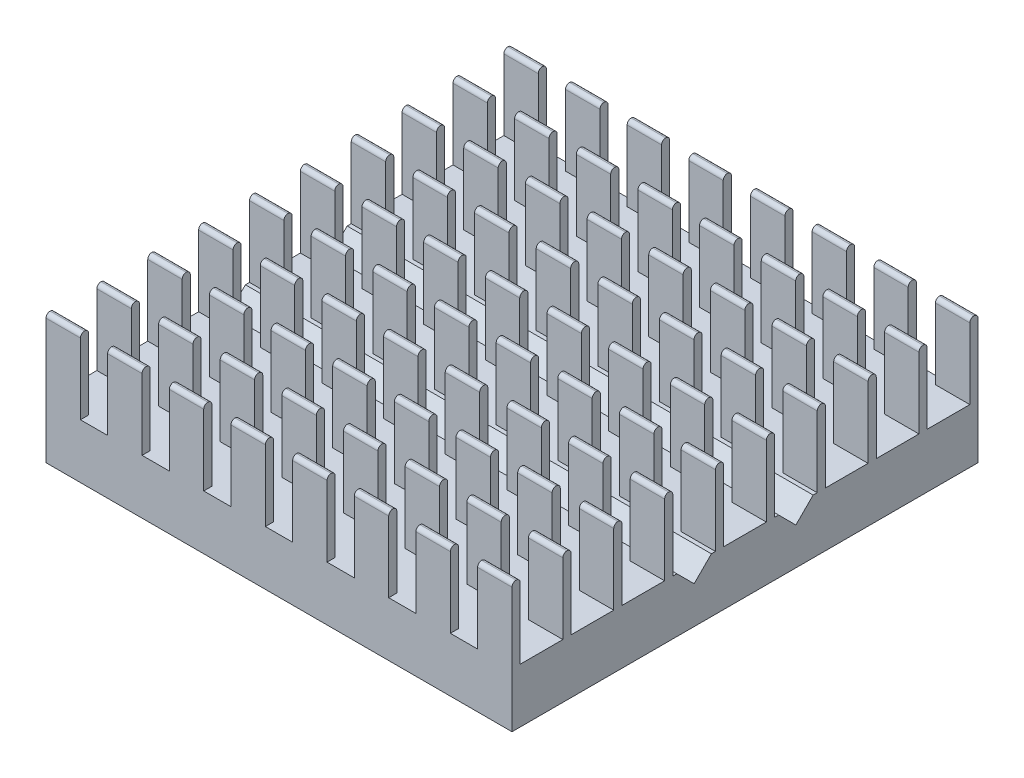
from build123d import *

# Parameters (mm, degrees)
BOSS_EXTRUDE1_START     = -4.75
SKETCH3_W               = 34.25
SKETCH3_H               = 34.25
BOSS_EXTRUDE1_DEPTH     = 4
BOSS_EXTRUDE2_START     = -0.75
SKETCH4_W               = 2.53
SKETCH4_H               = 0.6
BOSS_EXTRUDE2_DEPTH     = 5.5
FILLET1_R               = 0.3
LPATTERN1_COUNT         = 8
LPATTERN1_PITCH         = 4.531428571
LPATTERN1_COUNT_DIR2    = 10
LPATTERN1_PITCH_DIR2    = 3.738888889
FILLET1_OF_LPATTERN1_R  = 0.3
CUT_EXTRUDE1_DEPTH      = 25.679824756
CUT_EXTRUDE1_DEPTH_BACK = 25.679824756


with BuildPart() as part:
    # Sketch3 → Boss-Extrude1 (new body)
    with BuildSketch(Plane(origin=(0, 0, 0), x_dir=(1, 0, 0), z_dir=(0, 1, 0)).offset(BOSS_EXTRUDE1_START)):
        Rectangle(SKETCH3_W, SKETCH3_H)
    extrude(amount=BOSS_EXTRUDE1_DEPTH)

    # Sketch4 → Boss-Extrude2 (add)
    with BuildSketch(Plane(origin=(0, 0, 0), x_dir=(1, 0, 0), z_dir=(0, 1, 0)).offset(BOSS_EXTRUDE2_START)):
        with Locations((-15.86, -16.825)):
            Rectangle(SKETCH4_W, SKETCH4_H)
    boss_extrude2 = extrude(amount=BOSS_EXTRUDE2_DEPTH)

    # Fillet1
    fillet1_edges = [part.edges().sort_by_distance(p)[0] for p in [
        (-15.86, 4.75, 16.525),
        (-15.86, 4.75, 17.125),
    ]]
    fillet(fillet1_edges, radius=FILLET1_R - 0.0001)  # a hair under: the kernel refuses the full size

    # LPattern1: Boss-Extrude2 8 × 10
    with Locations(*[(i * LPATTERN1_PITCH, 0, -j * LPATTERN1_PITCH_DIR2) for i in range(LPATTERN1_COUNT) for j in range(LPATTERN1_COUNT_DIR2) if (i, j) != (0, 0)]):
        add(boss_extrude2)

    # Fillet1 of LPattern1
    fillet1_of_lpattern1_edges = [part.edges().sort_by_distance(p)[0] for p in [
        (-15.86, 4.75, 12.786111111),
        (-15.86, 4.75, 13.386111111),
        (-15.86, 4.75, 9.047222222),
        (-15.86, 4.75, 9.647222222),
        (-15.86, 4.75, 5.308333333),
        (-15.86, 4.75, 5.908333333),
        (-15.86, 4.75, 1.569444444),
        (-15.86, 4.75, 2.169444444),
        (-15.86, 4.75, -2.169444444),
        (-15.86, 4.75, -1.569444444),
        (-15.86, 4.75, -5.908333333),
        (-15.86, 4.75, -5.308333333),
        (-15.86, 4.75, -9.647222222),
        (-15.86, 4.75, -9.047222222),
        (-15.86, 4.75, -13.386111111),
        (-15.86, 4.75, -12.786111111),
        (-15.86, 4.75, -17.125),
        (-15.86, 4.75, -16.525),
        (-11.328571429, 4.75, 16.525),
        (-11.328571429, 4.75, 17.125),
        (-11.328571429, 4.75, 12.786111111),
        (-11.328571429, 4.75, 13.386111111),
        (-11.328571429, 4.75, 9.047222222),
        (-11.328571429, 4.75, 9.647222222),
        (-11.328571429, 4.75, 5.308333333),
        (-11.328571429, 4.75, 5.908333333),
        (-11.328571429, 4.75, 1.569444444),
        (-11.328571429, 4.75, 2.169444444),
        (-11.328571429, 4.75, -2.169444444),
        (-11.328571429, 4.75, -1.569444444),
        (-11.328571429, 4.75, -5.908333333),
        (-11.328571429, 4.75, -5.308333333),
        (-11.328571429, 4.75, -9.647222222),
        (-11.328571429, 4.75, -9.047222222),
        (-11.328571429, 4.75, -13.386111111),
        (-11.328571429, 4.75, -12.786111111),
        (-11.328571429, 4.75, -17.125),
        (-11.328571429, 4.75, -16.525),
        (-6.797142857, 4.75, 16.525),
        (-6.797142857, 4.75, 17.125),
        (-6.797142857, 4.75, 12.786111111),
        (-6.797142857, 4.75, 13.386111111),
        (-6.797142857, 4.75, 9.047222222),
        (-6.797142857, 4.75, 9.647222222),
        (-6.797142857, 4.75, 5.308333333),
        (-6.797142857, 4.75, 5.908333333),
        (-6.797142857, 4.75, 1.569444444),
        (-6.797142857, 4.75, 2.169444444),
        (-6.797142857, 4.75, -2.169444444),
        (-6.797142857, 4.75, -1.569444444),
        (-6.797142857, 4.75, -5.908333333),
        (-6.797142857, 4.75, -5.308333333),
        (-6.797142857, 4.75, -9.647222222),
        (-6.797142857, 4.75, -9.047222222),
        (-6.797142857, 4.75, -13.386111111),
        (-6.797142857, 4.75, -12.786111111),
        (-6.797142857, 4.75, -17.125),
        (-6.797142857, 4.75, -16.525),
        (-2.265714286, 4.75, 16.525),
        (-2.265714286, 4.75, 17.125),
        (-2.265714286, 4.75, 12.786111111),
        (-2.265714286, 4.75, 13.386111111),
        (-2.265714286, 4.75, 9.047222222),
        (-2.265714286, 4.75, 9.647222222),
        (-2.265714286, 4.75, 5.308333333),
        (-2.265714286, 4.75, 5.908333333),
        (-2.265714286, 4.75, 1.569444444),
        (-2.265714286, 4.75, 2.169444444),
        (-2.265714286, 4.75, -2.169444444),
        (-2.265714286, 4.75, -1.569444444),
        (-2.265714286, 4.75, -5.908333333),
        (-2.265714286, 4.75, -5.308333333),
        (-2.265714286, 4.75, -9.647222222),
        (-2.265714286, 4.75, -9.047222222),
        (-2.265714286, 4.75, -13.386111111),
        (-2.265714286, 4.75, -12.786111111),
        (-2.265714286, 4.75, -17.125),
        (-2.265714286, 4.75, -16.525),
        (2.265714286, 4.75, 16.525),
        (2.265714286, 4.75, 17.125),
        (2.265714286, 4.75, 12.786111111),
        (2.265714286, 4.75, 13.386111111),
        (2.265714286, 4.75, 9.047222222),
        (2.265714286, 4.75, 9.647222222),
        (2.265714286, 4.75, 5.308333333),
        (2.265714286, 4.75, 5.908333333),
        (2.265714286, 4.75, 1.569444444),
        (2.265714286, 4.75, 2.169444444),
        (2.265714286, 4.75, -2.169444444),
        (2.265714286, 4.75, -1.569444444),
        (2.265714286, 4.75, -5.908333333),
        (2.265714286, 4.75, -5.308333333),
        (2.265714286, 4.75, -9.647222222),
        (2.265714286, 4.75, -9.047222222),
        (2.265714286, 4.75, -13.386111111),
        (2.265714286, 4.75, -12.786111111),
        (2.265714286, 4.75, -17.125),
        (2.265714286, 4.75, -16.525),
        (6.797142857, 4.75, 16.525),
        (6.797142857, 4.75, 17.125),
        (6.797142857, 4.75, 12.786111111),
        (6.797142857, 4.75, 13.386111111),
        (6.797142857, 4.75, 9.047222222),
        (6.797142857, 4.75, 9.647222222),
        (6.797142857, 4.75, 5.308333333),
        (6.797142857, 4.75, 5.908333333),
        (6.797142857, 4.75, 1.569444444),
        (6.797142857, 4.75, 2.169444444),
        (6.797142857, 4.75, -2.169444444),
        (6.797142857, 4.75, -1.569444444),
        (6.797142857, 4.75, -5.908333333),
        (6.797142857, 4.75, -5.308333333),
        (6.797142857, 4.75, -9.647222222),
        (6.797142857, 4.75, -9.047222222),
        (6.797142857, 4.75, -13.386111111),
        (6.797142857, 4.75, -12.786111111),
        (6.797142857, 4.75, -17.125),
        (6.797142857, 4.75, -16.525),
        (11.328571429, 4.75, 16.525),
        (11.328571429, 4.75, 17.125),
        (11.328571429, 4.75, 12.786111111),
        (11.328571429, 4.75, 13.386111111),
        (11.328571429, 4.75, 9.047222222),
        (11.328571429, 4.75, 9.647222222),
        (11.328571429, 4.75, 5.308333333),
        (11.328571429, 4.75, 5.908333333),
        (11.328571429, 4.75, 1.569444444),
        (11.328571429, 4.75, 2.169444444),
        (11.328571429, 4.75, -2.169444444),
        (11.328571429, 4.75, -1.569444444),
        (11.328571429, 4.75, -5.908333333),
        (11.328571429, 4.75, -5.308333333),
        (11.328571429, 4.75, -9.647222222),
        (11.328571429, 4.75, -9.047222222),
        (11.328571429, 4.75, -13.386111111),
        (11.328571429, 4.75, -12.786111111),
        (11.328571429, 4.75, -17.125),
        (11.328571429, 4.75, -16.525),
        (15.86, 4.75, 16.525),
        (15.86, 4.75, 17.125),
        (15.86, 4.75, 12.786111111),
        (15.86, 4.75, 13.386111111),
        (15.86, 4.75, 9.047222222),
        (15.86, 4.75, 9.647222222),
        (15.86, 4.75, 5.308333333),
        (15.86, 4.75, 5.908333333),
        (15.86, 4.75, 1.569444444),
        (15.86, 4.75, 2.169444444),
        (15.86, 4.75, -2.169444444),
        (15.86, 4.75, -1.569444444),
        (15.86, 4.75, -5.908333333),
        (15.86, 4.75, -5.308333333),
        (15.86, 4.75, -9.647222222),
        (15.86, 4.75, -9.047222222),
        (15.86, 4.75, -13.386111111),
        (15.86, 4.75, -12.786111111),
        (15.86, 4.75, -17.125),
        (15.86, 4.75, -16.525),
    ]]
    fillet(fillet1_of_lpattern1_edges, radius=FILLET1_OF_LPATTERN1_R - 0.0001)  # a hair under: the kernel refuses the full size

    # Sketch5 → Cut-Extrude1 (cut, two sides: drawn at the far end of the back side and taken through both)
    with BuildSketch(Plane(origin=(0, 0, 0), x_dir=(0, 0, -1), z_dir=(1, 0, 0)).offset(-CUT_EXTRUDE1_DEPTH_BACK)):
        Polygon((-5.008333333, -0.75), (-3.738888889, -2.019444444), (-2.469444444, -0.75), align=None)
        Polygon((5.008333333, -0.75), (2.469444444, -0.75), (3.738888889, -2.019444444), align=None)
    extrude(amount=CUT_EXTRUDE1_DEPTH + CUT_EXTRUDE1_DEPTH_BACK, mode=Mode.SUBTRACT)


solid = part.part
